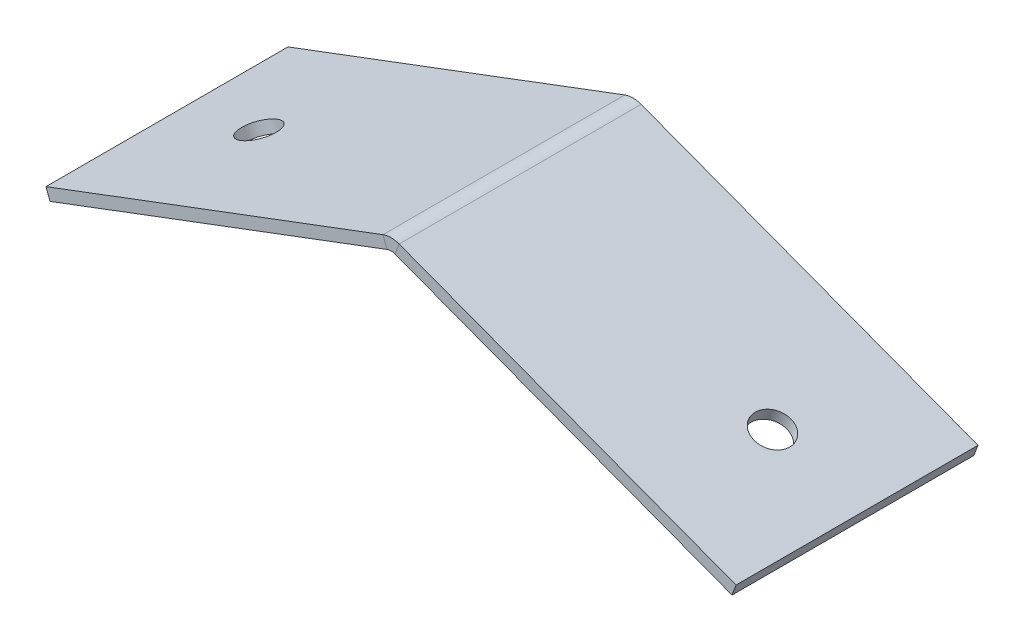
from build123d import *

# Parameters (mm, degrees)
BASE_FLANGE1_DEPTH = 16.66875
SKETCH2_R          = 2.54
CUT_EXTRUDE1_DEPTH = 2.54
SKETCH3_R          = 2.54
CUT_EXTRUDE2_DEPTH = 1.5875


# Sheet-metal steps are written as plain solids
with BuildPart() as part:
    # Sketch1 → Base-Flange1 (new, symmetric)
    with BuildSketch(Plane.XY):
        with BuildLine():
            Line((0, 0), (46.423806115, 17.477308657))
            ThreePointArc((46.423806115, 17.477308657), (47.542459326, 17.680904949), (48.661112536, 17.477308657))
            Line((48.661112536, 17.477308657), (95.084918652, 0))
            Line((95.084918652, 0), (94.525592046, -1.485701854))
            Line((94.525592046, -1.485701854), (48.101785931, 15.991606803))
            ThreePointArc((48.101785931, 15.991606803), (47.542459326, 16.093404949), (46.983132721, 15.991606803))
            Line((46.983132721, 15.991606803), (0.559326605, -1.485701854))
            Line((0.559326605, -1.485701854), (0, 0))
        make_face()
    extrude(amount=BASE_FLANGE1_DEPTH, both=True)

    # Sketch2 → Cut-Extrude1 (cut)
    with BuildSketch(Plane(origin=(0, 0, 0), x_dir=(0.9358751835780662, 0.3523317197794163, 0), z_dir=(-0.3523317197794163, 0.9358751835780662, 0))):
        with Locations(Location((13.536698287, 0, 0), (0, 0, 180))):
            Circle(SKETCH2_R)
    extrude(amount=-CUT_EXTRUDE1_DEPTH, mode=Mode.SUBTRACT)

    # Sketch3 → Cut-Extrude2 (cut)
    with BuildSketch(Plane(origin=(11.803617474, 31.353159678, 0), x_dir=(0.9358751835780662, -0.3523317197794163, 0), z_dir=(0.3523317197794163, 0.9358751835780662, 0))):
        with Locations(Location((76.541615699, 0, 0), (0, 0, 180))):
            Circle(SKETCH3_R)
    extrude(amount=-CUT_EXTRUDE2_DEPTH, mode=Mode.SUBTRACT)


solid = part.part
